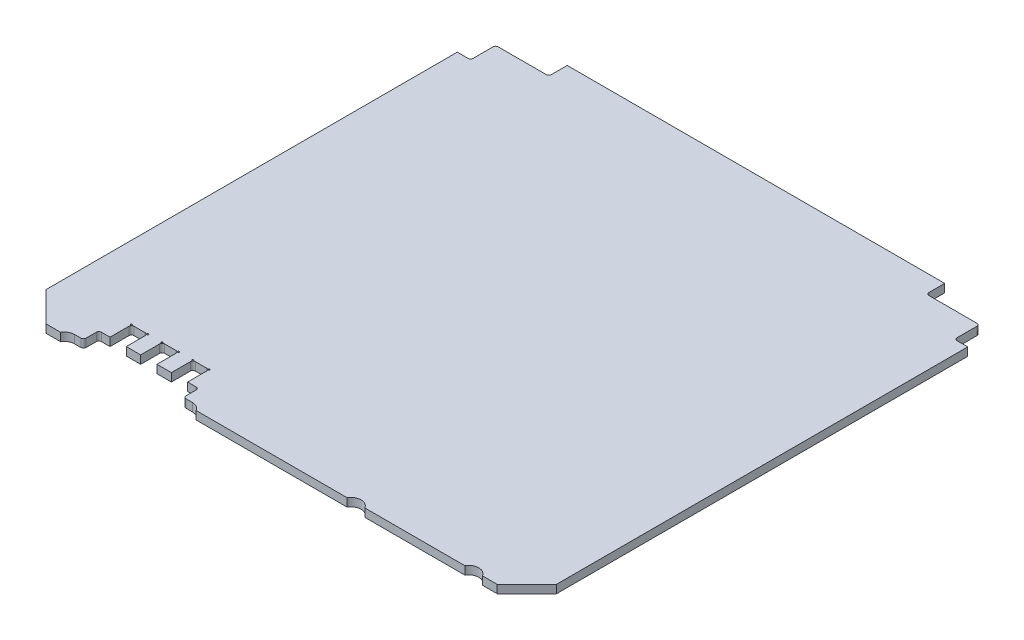
from build123d import *

# Parameters (mm, degrees)
GENERALSHAPE_DEPTH           = 0.8
ADDTOLERANCE_START           = -0.8
ADDTOLERANCE_DEPTH           = 1.6
BACKPLANE_DEPTH              = 71.573791169
BACKPLANE_DEPTH_BACK         = 71.573791169
RF_W                         = 3.18
RF_H                         = 4.2
CUT_EXTRUDE1_DEPTH           = 71.587392642
FILLET1_R                    = 0.5
F_0_32_0_32_DIAMETER_HOLE1_D = 0.32
FILLET2_R                    = 0.5


# Read off the part's stored shape, not the designer's step: AddTolerance
with BuildPart() as part:
    # Sketch2 → GeneralShape (new, symmetric)
    with BuildSketch(Plane(origin=(0, 0, 0), x_dir=(1, 0, 0), z_dir=(0, 1, 0))):
        Polygon((47.4, 46.4), (37, 46.4), (37, 50), (-37, 50), (-37, 46.4), (-47.4, 46.4), (-47.4, 41.5), (-50, 41.5), (-50, -38.9), (-41.5, -47.4), (41.5, -47.4), (50, -38.9), (50, 41.5), (47.4, 41.5), align=None)
    extrude(amount=GENERALSHAPE_DEPTH, both=True)

    # AddTolerance outline → AddTolerance (cut)
    with BuildSketch(Plane(origin=(0, 0, 0), x_dir=(1, 0, 0), z_dir=(0, 1, 0)).offset(ADDTOLERANCE_START)):
        Polygon((49.9, 41.4), (49.9, -39), (50, -38.9), (50, 41.5), (47.4, 41.5), (47.4, 46.4), (37, 46.4), (37, 50), (-37, 50), (-37, 46.4), (-47.4, 46.4), (-47.4, 41.5), (-50, 41.5), (-50, -38.9), (-49.9, -39), (-49.9, 41.4), (-47.3, 41.4), (-47.3, 46.3), (-36.9, 46.3), (-36.9, 49.9), (36.9, 49.9), (36.9, 46.3), (47.3, 46.3), (47.3, 41.4), align=None)
    extrude(amount=ADDTOLERANCE_DEPTH, mode=Mode.SUBTRACT)

    # Sketch4 → Backplane (cut, two sides: drawn at the far end of the back side and taken through both)
    with BuildSketch(Plane(origin=(0, 0, 0), x_dir=(1, 0, 0), z_dir=(0, 1, 0)).offset(-BACKPLANE_DEPTH_BACK)):
        with BuildLine():
            Line((41.5, -47.4), (44.1, -44.8))
            Line((44.1, -44.8), (41.232050808, -44.8))
            ThreePointArc((41.232050808, -44.8), (39.5, -43.8), (37.767949192, -44.8))
            Line((37.767949192, -44.8), (18.232050808, -44.8))
            ThreePointArc((18.232050808, -44.8), (16.5, -43.8), (14.767949192, -44.8))
            Line((14.767949192, -44.8), (-14.767949192, -44.8))
            ThreePointArc((-14.767949192, -44.8), (-16.5, -43.8), (-18.232050808, -44.8))
            Line((-18.232050808, -44.8), (-37.767949192, -44.8))
            ThreePointArc((-37.767949192, -44.8), (-39.5, -43.8), (-41.232050808, -44.8))
            Line((-41.232050808, -44.8), (-44.1, -44.8))
            Line((-44.1, -44.8), (-41.5, -47.4))
            Line((-41.5, -47.4), (41.5, -47.4))
        make_face()
    extrude(amount=BACKPLANE_DEPTH + BACKPLANE_DEPTH_BACK, mode=Mode.SUBTRACT)

    # RF → Cut-Extrude1 (cut, through all)
    with BuildSketch(Plane(origin=(0, 0.8, 0), x_dir=(1, 0, 0), z_dir=(0, 1, 0))):
        with Locations((-22, -38.7)):
            Rectangle(RF_W, RF_H)
        with Locations((-28, -38.7)):
            Rectangle(RF_W, RF_H)
        with Locations((-34, -38.7)):
            Rectangle(RF_W, RF_H)
        with BuildLine():
            Line((-18.232050808, -40.8), (-20.41, -40.8))
            Line((-20.41, -40.8), (-23.59, -40.8))
            Line((-23.59, -40.8), (-26.41, -40.8))
            Line((-26.41, -40.8), (-29.59, -40.8))
            Line((-29.59, -40.8), (-32.41, -40.8))
            Line((-32.41, -40.8), (-35.59, -40.8))
            Line((-35.59, -40.8), (-37.767949192, -40.8))
            Line((-37.767949192, -40.8), (-37.767949192, -43.8))
            Line((-37.767949192, -43.8), (-39.5, -43.8))
            ThreePointArc((-39.5, -43.8), (-38.5, -44.067949192), (-37.767949192, -44.8))
            Line((-37.767949192, -44.8), (-18.232050808, -44.8))
            ThreePointArc((-18.232050808, -44.8), (-17.5, -44.067949192), (-16.5, -43.8))
            Line((-16.5, -43.8), (-18.232050808, -43.8))
            Line((-18.232050808, -43.8), (-18.232050808, -40.8))
        make_face()
    extrude(amount=-CUT_EXTRUDE1_DEPTH, mode=Mode.SUBTRACT)

    # Fillet1
    fillet1_edges = [part.edges().sort_by_distance(p)[0] for p in [
        (-23.59, 0, 36.6),
        (-20.41, 0, 36.6),
        (-18.232050808, 0, 40.8),
        (-18.232050808, 0, 43.8),
        (-37.767949192, 0, 43.8),
        (-37.767949192, 0, 40.8),
        (-35.59, 0, 36.6),
        (-32.41, 0, 36.6),
        (-29.59, 0, 36.6),
        (-26.41, 0, 36.6),
    ]]
    fillet(fillet1_edges, radius=FILLET1_R)

    # Ø0.32 (0.32) Diameter Hole1 (through all)
    with Locations(Plane(origin=(0, 0.8, 0), x_dir=(1, 0, 0), z_dir=(0, 1, 0))):
        with Locations((-20.41, -36.6), (-23.59, -36.6), (-26.41, -36.6), (-29.59, -36.6), (-32.41, -36.6), (-35.59, -36.6)):
            Hole(F_0_32_0_32_DIAMETER_HOLE1_D / 2)

    # Fillet2
    fillet2_edges = [part.edges().sort_by_distance(p)[0] for p in [
        (47.3, 0, -41.4),
        (47.3, 0, -46.3),
        (36.9, 0, -46.3),
        (-36.9, 0, -46.3),
        (-47.3, 0, -46.3),
        (-47.3, 0, -41.4),
    ]]
    fillet(fillet2_edges, radius=FILLET2_R)


solid = part.part
